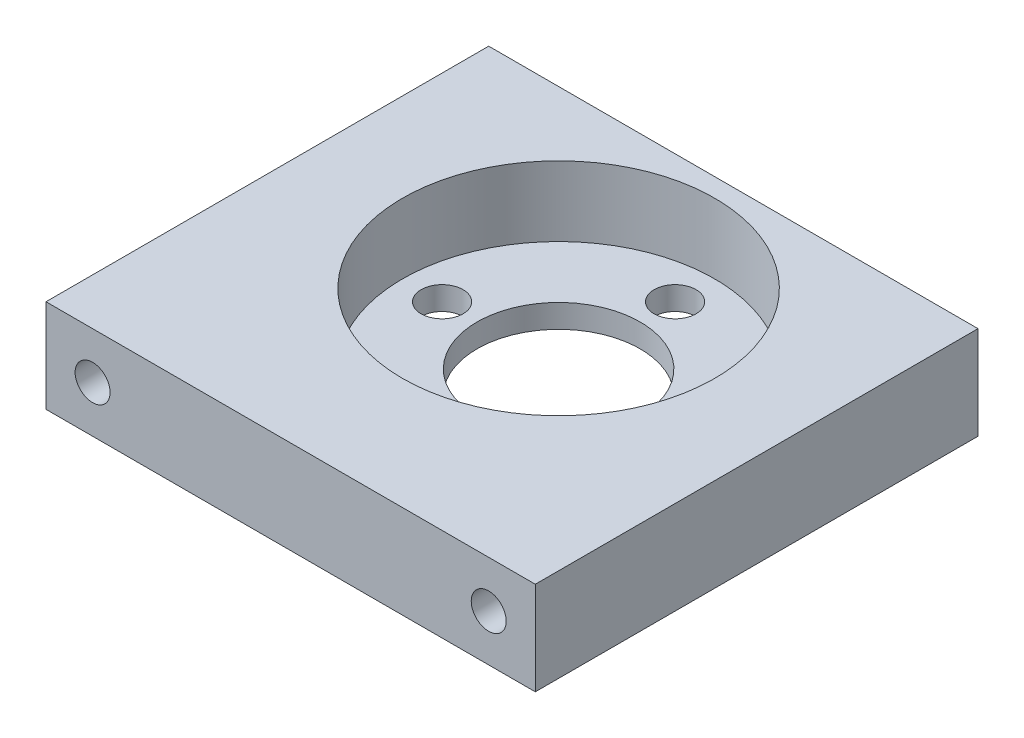
from build123d import *

# Parameters (mm, degrees)
ESQUISSE1_W             = 42
ESQUISSE1_H             = 46
BOSS_EXTRU_1_DEPTH      = 8
ESQUISSE2_R             = 13.4
ENL_V_MAT_EXTRU_1_DEPTH = 6
ESQUISSE3_R             = 7
ESQUISSE3_R_2           = 1.8
ENL_V_MAT_EXTRU_2_DEPTH = 63.577951389
ESQUISSE4_R             = 1.5
ENL_V_MAT_EXTRU_3_DEPTH = 63.801273872
ENL_V_MAT_EXTRU_4_REACH = 64.801
ESQUISSE5_W             = 42
ESQUISSE5_H             = 8


with BuildPart() as part:
    # Esquisse1 → Boss.-Extru.1 (new body)
    with BuildSketch(Plane(origin=(0, 0, 0), x_dir=(1, 0, 0), z_dir=(0, 1, 0))):
        with Locations((21, 23)):
            Rectangle(ESQUISSE1_W, ESQUISSE1_H)
    extrude(amount=BOSS_EXTRU_1_DEPTH)

    # Esquisse2 → Enlèv. mat.-Extru.1 (cut)
    with BuildSketch(Plane(origin=(0, 8, 0), x_dir=(1, 0, 0), z_dir=(0, 1, 0))):
        with Locations((21, 23)):
            Circle(ESQUISSE2_R)
    extrude(amount=-ENL_V_MAT_EXTRU_1_DEPTH, mode=Mode.SUBTRACT)

    # Esquisse3 → Enlèv. mat.-Extru.2 (cut, through all)
    with BuildSketch(Plane(origin=(0, 2, 0), x_dir=(1, 0, 0), z_dir=(0, 1, 0))):
        with Locations((21, 23)):
            Circle(ESQUISSE3_R)
        with Locations((21, 33)):
            Circle(ESQUISSE3_R_2)
        with Locations((31, 23)):
            Circle(ESQUISSE3_R_2)
        with Locations((21, 13)):
            Circle(ESQUISSE3_R_2)
        with Locations((11, 23)):
            Circle(ESQUISSE3_R_2)
    extrude(amount=-ENL_V_MAT_EXTRU_2_DEPTH, mode=Mode.SUBTRACT)

    # Esquisse4 → Enlèv. mat.-Extru.3 (cut, through all)
    with BuildSketch(Plane(origin=(0, 0, -46), x_dir=(-1, 0, 0), z_dir=(0, 0, -1))):
        with Locations((-38, 4)):
            Circle(ESQUISSE4_R)
        with Locations((-4, 4)):
            Circle(ESQUISSE4_R)
    extrude(amount=-ENL_V_MAT_EXTRU_3_DEPTH, mode=Mode.SUBTRACT)

    # Esquisse5 → Enlèv. mat.-Extru.4 (cut, up to next)
    with BuildSketch(Plane(origin=(0, 8, 0), x_dir=(1, 0, 0), z_dir=(0, 1, 0)), mode=Mode.PRIVATE) as enl_v_mat_extru_4_sk1:
        with Locations((21, 42)):
            Rectangle(ESQUISSE5_W, ESQUISSE5_H)
    enl_v_mat_extru_4_tool1 = extrude(enl_v_mat_extru_4_sk1.sketch, amount=-ENL_V_MAT_EXTRU_4_REACH, mode=Mode.PRIVATE) & part.part
    add(enl_v_mat_extru_4_tool1.solids().sort_by_distance((21, 8, -42))[0], mode=Mode.SUBTRACT)


solid = part.part
